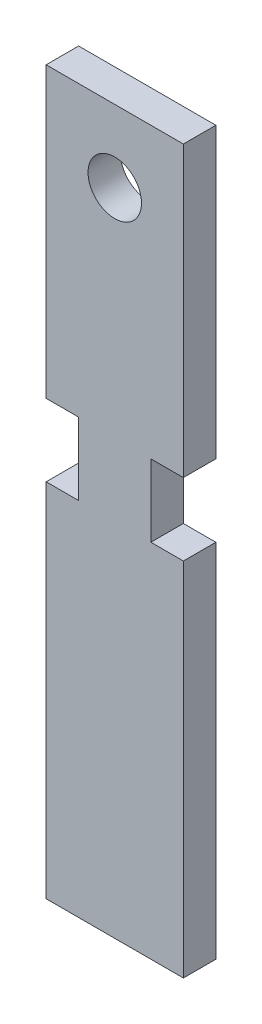
from build123d import *

# Parameters (mm, degrees)
SKETCH1_W           = 50.8
SKETCH1_H           = 127
BOSS_EXTRUDE1_DEPTH = 5.715
SKETCH2_R           = 4.699
SKETCH2_W           = 5.715
SKETCH2_H           = 12.7
CUT_EXTRUDE1_DEPTH  = 69.629958655
SKETCH3_W           = 13.335
SKETCH3_H           = 127
CUT_EXTRUDE2_DEPTH  = 69.629958655


with BuildPart() as part:
    # Sketch1 → Boss-Extrude1 (new body)
    with BuildSketch(Plane.XY):
        Rectangle(SKETCH1_W, SKETCH1_H)
    extrude(amount=BOSS_EXTRUDE1_DEPTH)

    # Sketch2 → Cut-Extrude1 (cut, through all)
    with BuildSketch(Plane.XY.offset(5.715)):
        with Locations((0, 50.8)):
            Circle(SKETCH2_R)
        with Locations((-9.2075, 6.35)):
            Rectangle(SKETCH2_W, SKETCH2_H)
        with Locations((9.2075, 6.35)):
            Rectangle(SKETCH2_W, SKETCH2_H)
    extrude(amount=-CUT_EXTRUDE1_DEPTH, mode=Mode.SUBTRACT)

    # Sketch3 → Cut-Extrude2 (cut, through all)
    with BuildSketch(Plane.XY.offset(5.715)):
        with Locations((-18.7325, 0)):
            Rectangle(SKETCH3_W, SKETCH3_H)
        with Locations((18.7325, 0)):
            Rectangle(SKETCH3_W, SKETCH3_H)
    extrude(amount=-CUT_EXTRUDE2_DEPTH, mode=Mode.SUBTRACT)


solid = part.part
